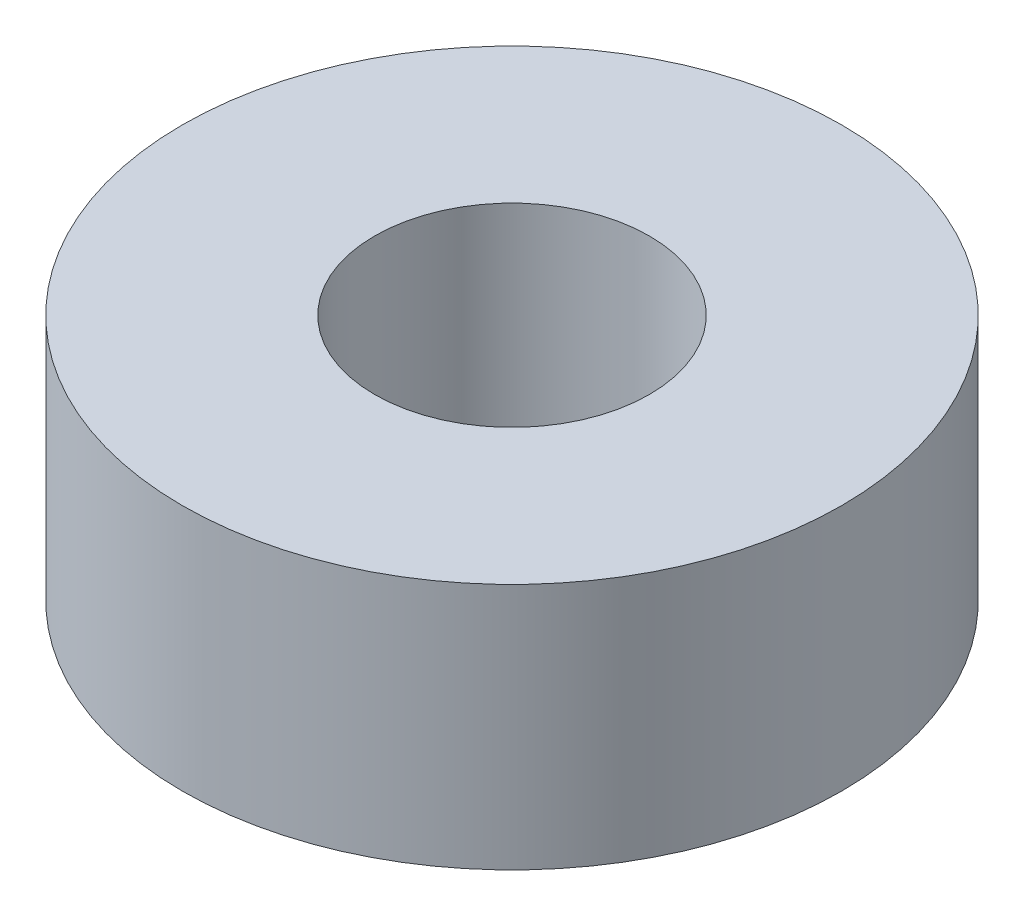
from build123d import *

# Parameters (mm, degrees)
SKETCH1_R           = 6
SKETCH1_R_2         = 2.5
BOSS_EXTRUDE1_DEPTH = 4.5


with BuildPart() as part:
    # Sketch1 → Boss-Extrude1 (new body)
    with BuildSketch(Plane(origin=(0, 0, 0), x_dir=(1, 0, 0), z_dir=(0, 1, 0))):
        Circle(SKETCH1_R)
        Circle(SKETCH1_R_2, mode=Mode.SUBTRACT)
    extrude(amount=BOSS_EXTRUDE1_DEPTH)


solid = part.part
